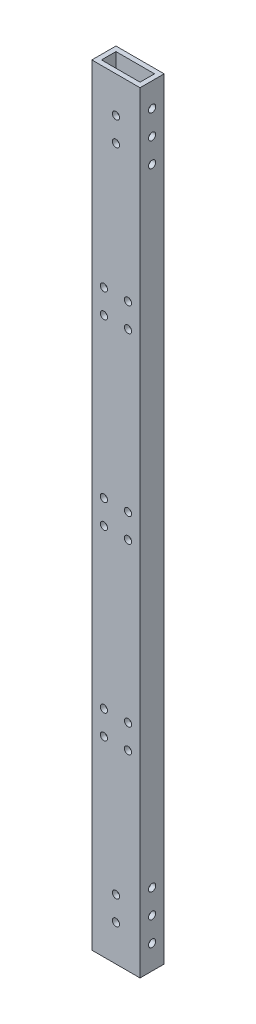
from build123d import *

# Parameters (mm, degrees)
SKETCH_1_W          = 20
SKETCH_1_H          = 10
SKETCH_1_W_2        = 16
SKETCH_1_H_2        = 6
EXTRUDE_1_DEPTH     = 160
SKETCH_3_R          = 1.5
CUT_EXTRUDE_1_DEPTH = 162.322658049
SKETCH_4_R          = 1.5
CUT_EXTRUDE_2_DEPTH = 161.623784042
SKETCH_5_R          = 1.5
CUT_EXTRUDE_3_DEPTH = 161.623784042


with BuildPart() as part:
    # 草图1 → 凸台-拉伸1 (new, symmetric)
    with BuildSketch(Plane(origin=(0, 0, 0), x_dir=(1, 0, 0), z_dir=(0, 1, 0))):
        Rectangle(SKETCH_1_W, SKETCH_1_H)
        Rectangle(SKETCH_1_W_2, SKETCH_1_H_2, mode=Mode.SUBTRACT)
    extrude(amount=EXTRUDE_1_DEPTH, both=True)

    # 草图3 → 切除-拉伸1 (cut, through all)
    with BuildSketch(Plane(origin=(10, 0, 0), x_dir=(0, 0, -1), z_dir=(1, 0, 0))):
        with Locations((0, 150)):
            Circle(SKETCH_3_R)
        with Locations((0, 140)):
            Circle(SKETCH_3_R)
        with Locations((0, 130)):
            Circle(SKETCH_3_R)
        with Locations((0, -130)):
            Circle(SKETCH_3_R)
        with Locations((0, -140)):
            Circle(SKETCH_3_R)
        with Locations((0, -150)):
            Circle(SKETCH_3_R)
    extrude(amount=-CUT_EXTRUDE_1_DEPTH, mode=Mode.SUBTRACT)

    # 草图4 → 切除-拉伸2 (cut, through all)
    with BuildSketch(Plane(origin=(0, 0, -5), x_dir=(-1, 0, 0), z_dir=(0, 0, -1))):
        with Locations((-5, 70.7)):
            Circle(SKETCH_4_R)
        with Locations((-5, 80.7)):
            Circle(SKETCH_4_R)
        with Locations((5, 70.7)):
            Circle(SKETCH_4_R)
        with Locations((5, 80.7)):
            Circle(SKETCH_4_R)
        with Locations((5, -70.7)):
            Circle(SKETCH_4_R)
        with Locations((5, -80.7)):
            Circle(SKETCH_4_R)
        with Locations((-5, -80.7)):
            Circle(SKETCH_4_R)
        with Locations((-5, -70.7)):
            Circle(SKETCH_4_R)
        with Locations((0, 145)):
            Circle(SKETCH_4_R)
        with Locations((0, 135)):
            Circle(SKETCH_4_R)
        with Locations((0, -145)):
            Circle(SKETCH_4_R)
        with Locations((0, -135)):
            Circle(SKETCH_4_R)
    extrude(amount=-CUT_EXTRUDE_2_DEPTH, mode=Mode.SUBTRACT)

    # 草图5 → 切除-拉伸3 (cut, through all)
    with BuildSketch(Plane(origin=(0, 0, -5), x_dir=(-1, 0, 0), z_dir=(0, 0, -1))):
        with Locations((5, -5)):
            Circle(SKETCH_5_R)
        with Locations((-5, -5)):
            Circle(SKETCH_5_R)
        with Locations((-5, 5)):
            Circle(SKETCH_5_R)
        with Locations((5, 5)):
            Circle(SKETCH_5_R)
        with Locations((45, 5)):
            Circle(SKETCH_5_R)
        with Locations((45, -5)):
            Circle(SKETCH_5_R)
        with Locations((35, 5)):
            Circle(SKETCH_5_R)
        with Locations((35, -5)):
            Circle(SKETCH_5_R)
    extrude(amount=-CUT_EXTRUDE_3_DEPTH, mode=Mode.SUBTRACT)


solid = part.part
